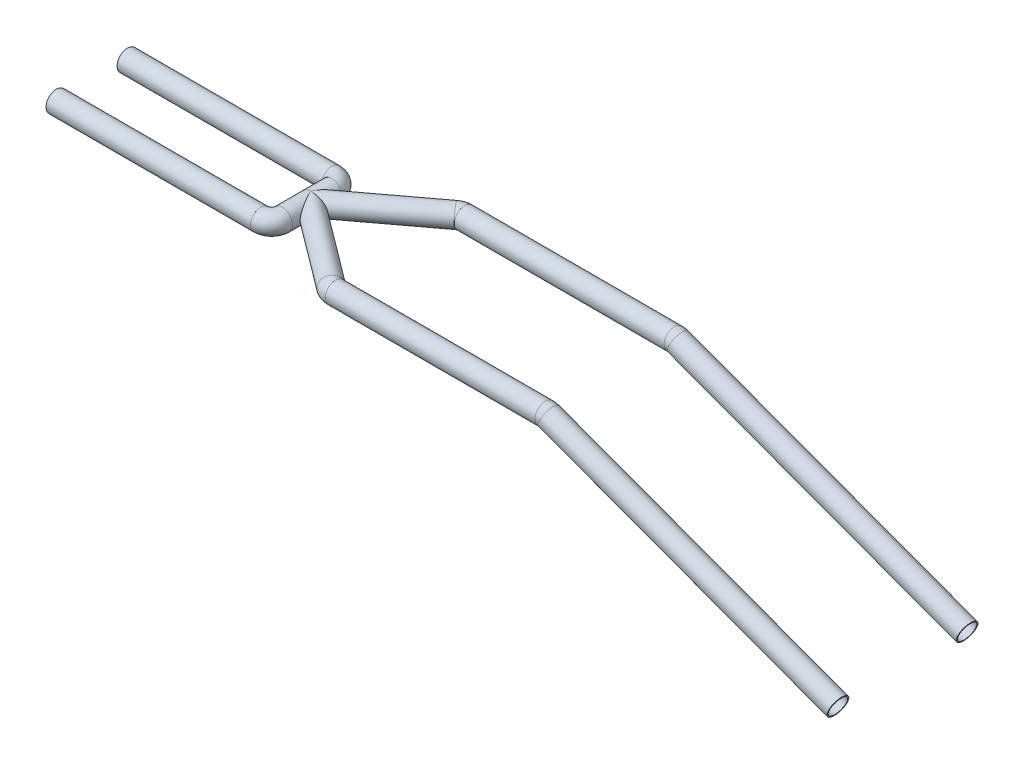
from build123d import *

# Parameters (mm, degrees)
STEERING_SUPPORT_START                       = -200
STEERING_SUPPORT_STEERING_SUPPORT_2_OUTL_R   = 9.6
STEERING_SUPPORT_STEERING_SUPPORT_2_OUTL_R_2 = 8.6
STEERING_SUPPORT_STEERING_SUPPORT_2_DEPTH    = 190
STEERING_SUPPORT_STEERING_SUPPORT_2_2_OU_R   = 9.6
STEERING_SUPPORT_STEERING_SUPPORT_2_2_OU_R_2 = 8.6
STEERING_SUPPORT_STEERING_SUPPORT_2_2_ANGLE  = 90
STEERING_SUPPORT_STEERING_SUPPORT_2_3_OU_R   = 9.6
STEERING_SUPPORT_STEERING_SUPPORT_2_3_OU_R_2 = 8.6
STEERING_SUPPORT_STEERING_SUPPORT_2_3_DEPTH  = 26.03577931
STEERING_SUPPORT_START_2                     = -20
STEERING_SUPPORT_STEERING_SUPPORT_2_4_OU_R   = 9.6
STEERING_SUPPORT_STEERING_SUPPORT_2_4_OU_R_2 = 8.6
STEERING_SUPPORT_STEERING_SUPPORT_2_4_DEPTH  = 20
STEERING_SUPPORT_STEERING_SUPPORT_2_5_OU_R   = 9.6
STEERING_SUPPORT_STEERING_SUPPORT_2_5_OU_R_2 = 8.6
STEERING_SUPPORT_STEERING_SUPPORT_2_5_ANGLE  = 90
STEERING_SUPPORT_STEERING_SUPPORT_2_6_OU_R   = 9.6
STEERING_SUPPORT_STEERING_SUPPORT_2_6_OU_R_2 = 8.6
STEERING_SUPPORT_STEERING_SUPPORT_2_6_DEPTH  = 190
SKETCH16_R                                   = 9.6
SKETCH16_R_2                                 = 8.6
STEERING_SUPPORT_STEERING_SUPPORT_4_DEPTH    = 96.666666667
SKETCH16_ON_SEGMENT_2_R                      = 9.6
SKETCH16_ON_SEGMENT_2_R_2                    = 8.6
STEERING_SUPPORT_STEERING_SUPPORT_4_2_ANGLE  = 36.869897646
SKETCH16_ON_SEGMENT_3_R                      = 9.6
SKETCH16_ON_SEGMENT_3_R_2                    = 8.6
STEERING_SUPPORT_STEERING_SUPPORT_4_3_DEPTH  = 196.666666667
SKETCH17_R                                   = 9.6
SKETCH17_R_2                                 = 8.6
STEERING_SUPPORT_STEERING_SUPPORT_5_DEPTH    = 194.874306569
SKETCH17_ON_SEGMENT_2_R                      = 9.6
SKETCH17_ON_SEGMENT_2_R_2                    = 8.6
STEERING_SUPPORT_STEERING_SUPPORT_5_2_ANGLE  = 20.32313683
SKETCH17_ON_SEGMENT_3_R                      = 9.6
SKETCH17_ON_SEGMENT_3_R_2                    = 8.6
STEERING_SUPPORT_STEERING_SUPPORT_5_3_DEPTH  = 286.13124088
SKETCH19_ON_SEGMENT_1_R                      = 9.6
SKETCH19_ON_SEGMENT_1_R_2                    = 8.6
STEERING_SUPPORT_STEERING_SUPPORT_6_ANGLE    = 20.32313683
SKETCH19_R                                   = 9.6
SKETCH19_R_2                                 = 8.6
STEERING_SUPPORT_STEERING_SUPPORT_6_2_DEPTH  = 286.13124088
SKETCH110_R                                  = 9.6
SKETCH110_R_2                                = 8.6
STEERING_SUPPORT_STEERING_SUPPORT_7_DEPTH    = 96.666666667
SKETCH110_ON_SEGMENT_2_R                     = 9.6
SKETCH110_ON_SEGMENT_2_R_2                   = 8.6
STEERING_SUPPORT_STEERING_SUPPORT_7_2_ANGLE  = 36.869897646
SKETCH110_ON_SEGMENT_3_R                     = 9.6
SKETCH110_ON_SEGMENT_3_R_2                   = 8.6
STEERING_SUPPORT_STEERING_SUPPORT_7_3_DEPTH  = 194.874306569


# Read off the part's stored shape, not the designer's step: Steering_support STEERING SUPPORT(2)
with BuildPart() as part:
    # Steering_support STEERING SUPPORT(2) outl → Steering_support STEERING SUPPORT(2) (new body)
    with BuildSketch(Plane.YZ.offset(STEERING_SUPPORT_START)):
        with Locations((0, 36.03577931)):
            Circle(STEERING_SUPPORT_STEERING_SUPPORT_2_OUTL_R)
        with Locations((0, 36.03577931)):
            Circle(STEERING_SUPPORT_STEERING_SUPPORT_2_OUTL_R_2, mode=Mode.SUBTRACT)
    extrude(amount=STEERING_SUPPORT_STEERING_SUPPORT_2_DEPTH)


with BuildPart() as body_2:
    # Steering_support STEERING SUPPORT_2 2 ou → Steering_support STEERING SUPPORT_2 2 (revolve)
    with BuildSketch(Plane(origin=(-10, 0, 26.03577931), x_dir=(0, 0, 1), z_dir=(-1, 0, 0))):
        with Locations((10, 0)):
            Circle(STEERING_SUPPORT_STEERING_SUPPORT_2_2_OU_R)
        with Locations((10, 0)):
            Circle(STEERING_SUPPORT_STEERING_SUPPORT_2_2_OU_R_2, mode=Mode.SUBTRACT)
    revolve(axis=Axis((-10, 0, 26.03577931), (0, 1, 0)), revolution_arc=STEERING_SUPPORT_STEERING_SUPPORT_2_2_ANGLE)


with BuildPart() as body_3:
    # Steering_support STEERING SUPPORT_2 3 ou → Steering_support STEERING SUPPORT_2 3 (new body)
    with BuildSketch(Plane.XY):
        Circle(STEERING_SUPPORT_STEERING_SUPPORT_2_3_OU_R)
        Circle(STEERING_SUPPORT_STEERING_SUPPORT_2_3_OU_R_2, mode=Mode.SUBTRACT)
    extrude(amount=STEERING_SUPPORT_STEERING_SUPPORT_2_3_DEPTH)


with BuildPart() as body_4:
    # Steering_support STEERING SUPPORT_2 4 ou → Steering_support STEERING SUPPORT_2 4 (new body)
    with BuildSketch(Plane.XY.offset(STEERING_SUPPORT_START_2)):
        Circle(STEERING_SUPPORT_STEERING_SUPPORT_2_4_OU_R)
        Circle(STEERING_SUPPORT_STEERING_SUPPORT_2_4_OU_R_2, mode=Mode.SUBTRACT)
    extrude(amount=STEERING_SUPPORT_STEERING_SUPPORT_2_4_DEPTH)


with BuildPart() as body_5:
    # Steering_support STEERING SUPPORT_2 5 ou → Steering_support STEERING SUPPORT_2 5 (revolve)
    with BuildSketch(Plane(origin=(-10, 0, -20), x_dir=(1, 0, 0), z_dir=(0, 0, 1))):
        with Locations((10, 0)):
            Circle(STEERING_SUPPORT_STEERING_SUPPORT_2_5_OU_R)
        with Locations((10, 0)):
            Circle(STEERING_SUPPORT_STEERING_SUPPORT_2_5_OU_R_2, mode=Mode.SUBTRACT)
    revolve(axis=Axis((-10, 0, -20), (0, 1, 0)), revolution_arc=STEERING_SUPPORT_STEERING_SUPPORT_2_5_ANGLE)


with BuildPart() as body_6:
    # Steering_support STEERING SUPPORT_2 6 ou → Steering_support STEERING SUPPORT_2 6 (new body)
    with BuildSketch(Plane.YZ.offset(STEERING_SUPPORT_START)):
        with Locations((0, -30)):
            Circle(STEERING_SUPPORT_STEERING_SUPPORT_2_6_OU_R)
        with Locations((0, -30)):
            Circle(STEERING_SUPPORT_STEERING_SUPPORT_2_6_OU_R_2, mode=Mode.SUBTRACT)
    extrude(amount=STEERING_SUPPORT_STEERING_SUPPORT_2_6_DEPTH)


with BuildPart() as body_7:
    # Sketch16 → Steering_support STEERING SUPPORT(4) (new body)
    with BuildSketch(Plane(origin=(0, 0, 0), x_dir=(0.6, 0, -0.8), z_dir=(0.8, 0, 0.6))):
        Circle(SKETCH16_R)
        Circle(SKETCH16_R_2, mode=Mode.SUBTRACT)
    extrude(amount=STEERING_SUPPORT_STEERING_SUPPORT_4_DEPTH)


with BuildPart() as body_8:
    # Sketch16 on segment 2 (carried to the start of arc 2) → Steering_support STEERING SUPPORT_4 2 (revolve)
    with BuildSketch(Plane(origin=(77.333333333, 0, 58), x_dir=(0.6, 0, -0.8), z_dir=(0.8, 0, 0.6))):
        Circle(SKETCH16_ON_SEGMENT_2_R)
        Circle(SKETCH16_ON_SEGMENT_2_R_2, mode=Mode.SUBTRACT)
    revolve(axis=Axis((83.333333333, 0, 50), (0, 1, 0)), revolution_arc=STEERING_SUPPORT_STEERING_SUPPORT_4_2_ANGLE)


with BuildPart() as body_9:
    # Sketch16 on segment 3 (carried to segment 3) → Steering_support STEERING SUPPORT_4 3 (new body)
    with BuildSketch(Plane(origin=(83.333333333, 0, 60), x_dir=(0, 0, -1), z_dir=(1, 0, 0))):
        Circle(SKETCH16_ON_SEGMENT_3_R)
        Circle(SKETCH16_ON_SEGMENT_3_R_2, mode=Mode.SUBTRACT)
    extrude(amount=STEERING_SUPPORT_STEERING_SUPPORT_4_3_DEPTH)


with BuildPart() as body_9_2:
    # Sketch17 → Steering_support STEERING SUPPORT(5) (new body)
    with BuildSketch(Plane(origin=(83.333333333, 0, 60), x_dir=(0, 1, 0), z_dir=(1, 0, 0))):
        Circle(SKETCH17_R)
        Circle(SKETCH17_R_2, mode=Mode.SUBTRACT)
    extrude(amount=STEERING_SUPPORT_STEERING_SUPPORT_5_DEPTH)


with BuildPart() as body_10:
    # Sketch17 on segment 2 (carried to the start of arc 2) → Steering_support STEERING SUPPORT_5 2 (revolve)
    with BuildSketch(Plane(origin=(278.207639902, 0, 60), x_dir=(0, 1, 0), z_dir=(1, 0, 0))):
        Circle(SKETCH17_ON_SEGMENT_2_R)
        Circle(SKETCH17_ON_SEGMENT_2_R_2, mode=Mode.SUBTRACT)
    revolve(axis=Axis((278.207639902, -10, 60), (0, 0, -1)), revolution_arc=STEERING_SUPPORT_STEERING_SUPPORT_5_2_ANGLE)


with BuildPart() as body_11:
    # Sketch17 on segment 3 (carried to segment 3) → Steering_support STEERING SUPPORT_5 3 (new body)
    with BuildSketch(Plane(origin=(281.68078346, -0.622512393, 60), x_dir=(0.347314356, 0.937748761, 0), z_dir=(0.937748761, -0.347314356, 0))):
        Circle(SKETCH17_ON_SEGMENT_3_R)
        Circle(SKETCH17_ON_SEGMENT_3_R_2, mode=Mode.SUBTRACT)
    extrude(amount=STEERING_SUPPORT_STEERING_SUPPORT_5_3_DEPTH)


with BuildPart() as body_12:
    # Sketch19 on segment 1 (carried to the start of arc 1) → Steering_support STEERING SUPPORT(6) (revolve)
    with BuildSketch(Plane(origin=(281.68078346, -0.622512393, -60), x_dir=(-0.347314356, -0.937748761, 0), z_dir=(-0.937748761, 0.347314356, 0))):
        Circle(SKETCH19_ON_SEGMENT_1_R)
        Circle(SKETCH19_ON_SEGMENT_1_R_2, mode=Mode.SUBTRACT)
    revolve(axis=Axis((278.207639902, -10, -60), (0, 0, 1)), revolution_arc=STEERING_SUPPORT_STEERING_SUPPORT_6_ANGLE)


with BuildPart() as body_13:
    # Sketch19 → Steering_support STEERING SUPPORT_6 2 (new body)
    with BuildSketch(Plane(origin=(281.68078346, -0.622512393, -60), x_dir=(0.347314355823594, 0.9377487607237036, 0), z_dir=(0.9377487607237037, -0.347314355823594, 0))):
        Circle(SKETCH19_R)
        Circle(SKETCH19_R_2, mode=Mode.SUBTRACT)
    extrude(amount=STEERING_SUPPORT_STEERING_SUPPORT_6_2_DEPTH)


with BuildPart() as body_14:
    # Sketch110 → Steering_support STEERING SUPPORT(7) (new body)
    with BuildSketch(Plane(origin=(0, 0, 0), x_dir=(-0.6, 0, -0.8), z_dir=(0.8, 0, -0.6))):
        Circle(SKETCH110_R)
        Circle(SKETCH110_R_2, mode=Mode.SUBTRACT)
    extrude(amount=STEERING_SUPPORT_STEERING_SUPPORT_7_DEPTH)


with BuildPart() as body_15:
    # Sketch110 on segment 2 (carried to the start of arc 2) → Steering_support STEERING SUPPORT_7 2 (revolve)
    with BuildSketch(Plane(origin=(77.333333333, 0, -58), x_dir=(-0.6, 0, -0.8), z_dir=(0.8, 0, -0.6))):
        Circle(SKETCH110_ON_SEGMENT_2_R)
        Circle(SKETCH110_ON_SEGMENT_2_R_2, mode=Mode.SUBTRACT)
    revolve(axis=Axis((83.333333333, 0, -50), (0, -1, 0)), revolution_arc=STEERING_SUPPORT_STEERING_SUPPORT_7_2_ANGLE)


with BuildPart() as body_16:
    # Sketch110 on segment 3 (carried to segment 3) → Steering_support STEERING SUPPORT_7 3 (new body)
    with BuildSketch(Plane(origin=(83.333333333, 0, -60), x_dir=(0, 0, -1), z_dir=(1, 0, 0))):
        Circle(SKETCH110_ON_SEGMENT_3_R)
        Circle(SKETCH110_ON_SEGMENT_3_R_2, mode=Mode.SUBTRACT)
    extrude(amount=STEERING_SUPPORT_STEERING_SUPPORT_7_3_DEPTH)


solid = Compound([part.part, body_2.part, body_3.part, body_4.part, body_5.part, body_6.part, body_7.part, body_8.part, body_9_2.part, body_10.part, body_11.part, body_12.part, body_13.part, body_14.part, body_15.part, body_16.part])
